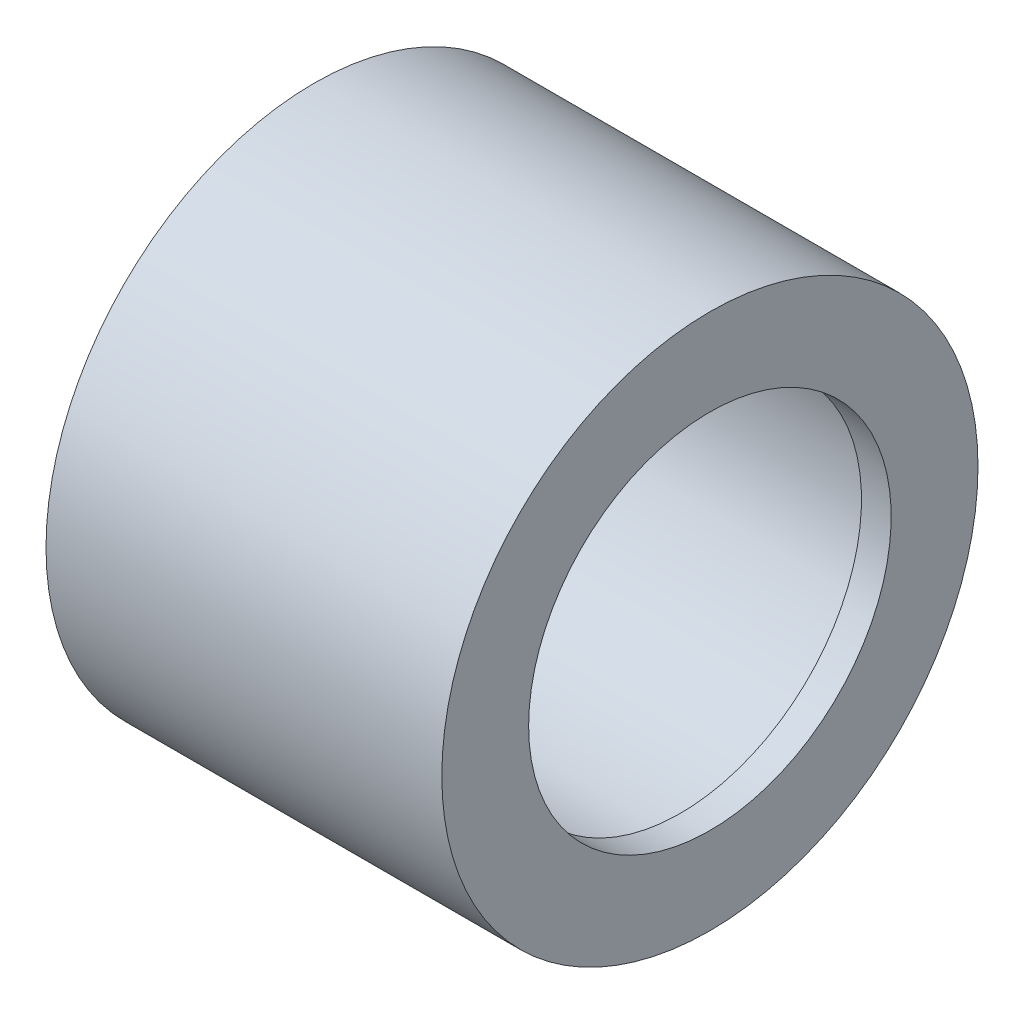
from build123d import *


with BuildPart() as part:
    # Sketch6 → Revolve1 (revolve)
    with BuildSketch(Plane.XY):
        Polygon((0, 18.32), (3, 18.32), (3, 20.32), (37, 20.32), (37, 18.32), (40, 18.32), (40, 27.093088703), (0, 27.093088703), align=None)
    revolve(axis=Axis((0, 0, 0), (1, 0, 0)))


solid = part.part
